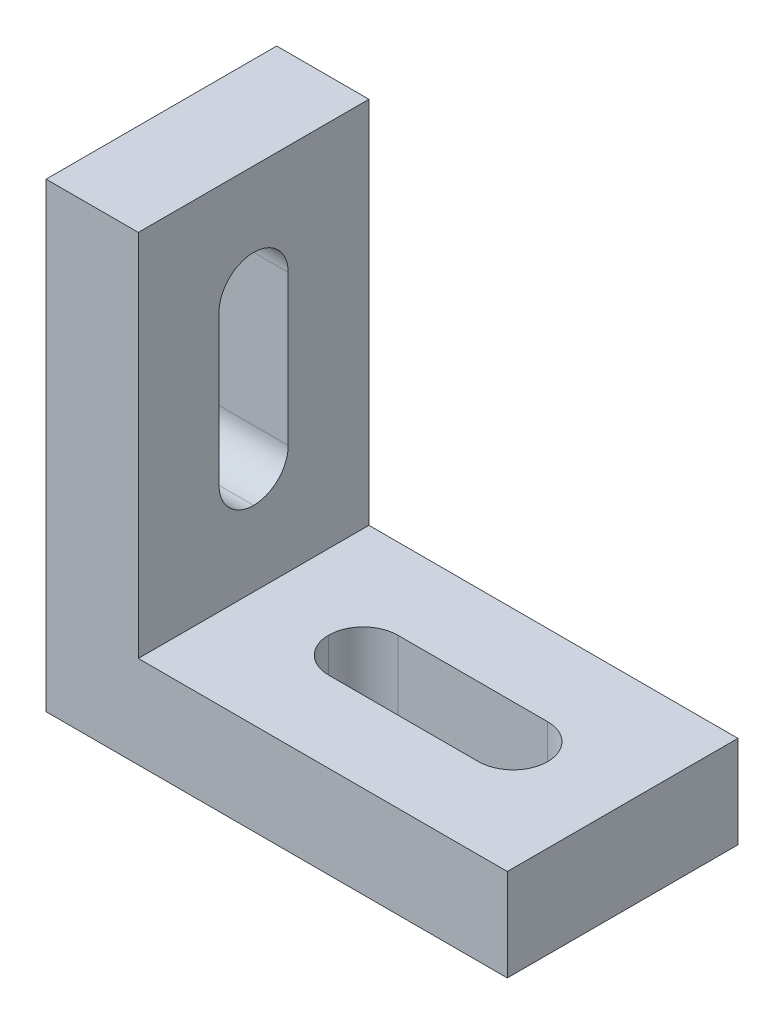
from build123d import *

# Parameters (mm, degrees)
BOSS_EXTRUDE1_DEPTH = 20
SKETCH2_W           = 19
SKETCH2_H           = 6
CUT_EXTRUDE1_DEPTH  = 20
SKETCH3_W           = 6
SKETCH3_H           = 19
CUT_EXTRUDE2_DEPTH  = 20
FILLET1_R           = 3


with BuildPart() as part:
    # Sketch1 → Boss-Extrude1 (new body)
    with BuildSketch(Plane.XY):
        Polygon((4, -20), (36, -20), (36, -12), (4, -12), (4, 20), (-4, 20), (-4, -20), align=None)
    extrude(amount=BOSS_EXTRUDE1_DEPTH)

    # Sketch2 → Cut-Extrude1 (cut)
    with BuildSketch(Plane(origin=(0, -12, 0), x_dir=(1, 0, 0), z_dir=(0, 1, 0))):
        with Locations((20, -10)):
            Rectangle(SKETCH2_W, SKETCH2_H)
    extrude(amount=-CUT_EXTRUDE1_DEPTH, mode=Mode.SUBTRACT)

    # Sketch3 → Cut-Extrude2 (cut)
    with BuildSketch(Plane(origin=(4, 0, 0), x_dir=(0, 0, -1), z_dir=(1, 0, 0))):
        with Locations((-10, 4)):
            Rectangle(SKETCH3_W, SKETCH3_H)
    extrude(amount=-CUT_EXTRUDE2_DEPTH, mode=Mode.SUBTRACT)

    # Fillet1
    fillet1_edges = [part.edges().sort_by_distance(p)[0] for p in [
        (29.5, -16, 7),
        (29.5, -16, 13),
        (10.5, -16, 7),
        (10.5, -16, 13),
        (0, -5.5, 13),
        (0, -5.5, 7),
        (0, 13.5, 13),
        (0, 13.5, 7),
    ]]
    fillet(fillet1_edges, radius=FILLET1_R - 0.0001)  # a hair under: the kernel refuses the full size


solid = part.part
